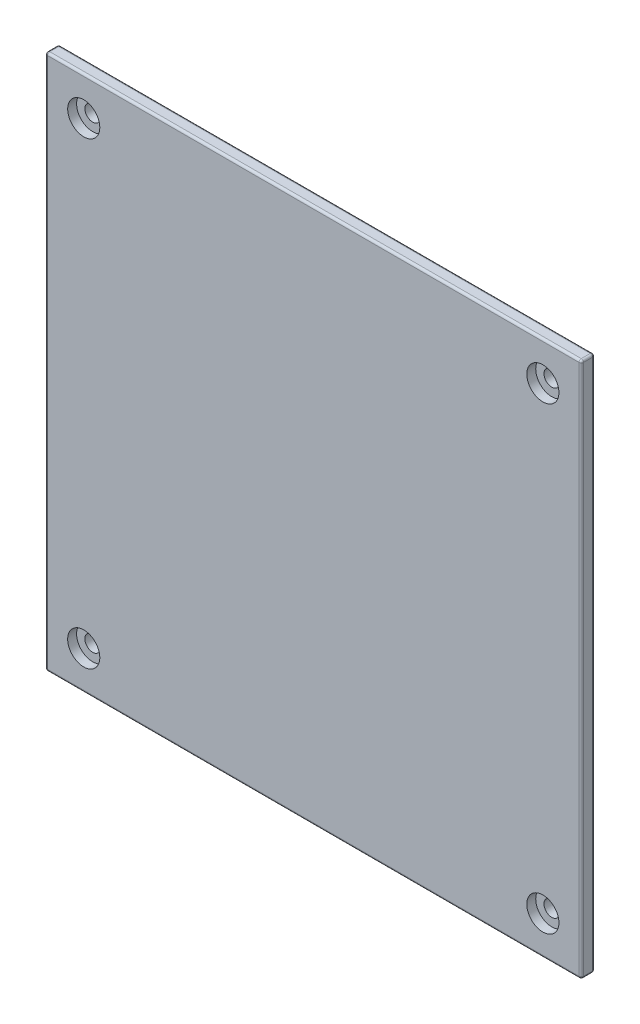
from build123d import *

# Parameters (mm, degrees)
ESBO_O1_W                 = 120
ESBO_O1_H                 = 120
RESSALTO_EXTRUS_O1_DEPTH  = 3
ESBO_O2_W                 = 112.8
ESBO_O2_H                 = 112.8
RESSALTO_EXTRUS_O2_DEPTH  = 2
ESBO_O3_W                 = 108.8
ESBO_O3_H                 = 108.8
CORTE_EXTRUS_O1_DEPTH     = 2
ESBO_O5_R                 = 5
RESSALTO_EXTRUS_O3_DEPTH  = 2
ESPELHAR2_COPY_1_SKETCH_R = 5
ESPELHAR2_COPY_1_DEPTH    = 2
CHANFRO1_SIZE             = 0.5
FILETE1_R                 = 2
ESBO_O6_R                 = 3.6
CORTE_EXTRUS_O2_DEPTH     = 2
ESBO_O7_R                 = 1.75
CORTE_EXTRUS_O3_DEPTH     = 85.905830189
ESPELHAR4_COPY_1_SKETCH_R = 3.6
ESPELHAR4_COPY_1_DEPTH    = 2
ESPELHAR4_COPY_2_SKETCH_R = 1.75
ESPELHAR4_COPY_2_DEPTH    = 85.905830189
FILETE2_R                 = 0.5


with BuildPart() as part:
    # Esboço1 → Ressalto-extrusão1 (new body)
    with BuildSketch(Plane.XY):
        Rectangle(ESBO_O1_W, ESBO_O1_H)
    extrude(amount=RESSALTO_EXTRUS_O1_DEPTH)

    # Esboço2 → Ressalto-extrusão2 (add)
    with BuildSketch(Plane(origin=(0, 0, 0), x_dir=(-1, 0, 0), z_dir=(0, 0, -1))):
        Rectangle(ESBO_O2_W, ESBO_O2_H)
    extrude(amount=RESSALTO_EXTRUS_O2_DEPTH)

    # Esboço3 → Corte-extrusão1 (cut)
    with BuildSketch(Plane(origin=(0, 0, -2), x_dir=(-1, 0, 0), z_dir=(0, 0, -1))):
        Rectangle(ESBO_O3_W, ESBO_O3_H)
    extrude(amount=-CORTE_EXTRUS_O1_DEPTH, mode=Mode.SUBTRACT)

    # Esboço5 → Ressalto-extrusão3 (add)
    with BuildSketch(Plane(origin=(0, 0, 0), x_dir=(-1, 0, 0), z_dir=(0, 0, -1))):
        with Locations((51.4, 51.4)):
            Circle(ESBO_O5_R)
    ressalto_extrus_o3 = extrude(amount=RESSALTO_EXTRUS_O3_DEPTH)

    # Espelhar1: Ressalto-extrusão3 across plane
    add(ressalto_extrus_o3.mirror(Plane(origin=(0, 0, 0), x_dir=(0, 0, 1), z_dir=(1, 0, 0))))

    # Espelhar2: Ressalto-extrusão3 across plane
    add(ressalto_extrus_o3.mirror(Plane.ZX))

    # Espelhar2 copy 1 sketch → Espelhar2 copy 1 (add)
    with BuildSketch(Plane(origin=(0, 0, 0), x_dir=(1, 0, 0), z_dir=(0, 0, -1))):
        with Locations((51.4, 51.4)):
            Circle(ESPELHAR2_COPY_1_SKETCH_R)
    extrude(amount=ESPELHAR2_COPY_1_DEPTH)

    # Chanfro1
    chanfro1_edges = [part.edges().sort_by_distance(p)[0] for p in [
        (0, 56.4, -2),
        (56.4, 0, -2),
        (0, -56.4, -2),
        (-56.4, 0, -2),
    ]]
    chamfer(chanfro1_edges, length=CHANFRO1_SIZE)

    # Filete1
    filete1_edges = [part.edges().sort_by_distance(p)[0] for p in [
        (0, -54.4, 0),
        (47.864466094, -47.864466094, 0),
        (54.4, 0, 0),
        (47.864466094, 47.864466094, 0),
        (0, 54.4, 0),
        (-47.864466094, 47.864466094, 0),
        (-54.4, 0, 0),
        (-47.864466094, -47.864466094, 0),
    ]]
    fillet(filete1_edges, radius=FILETE1_R - 0.0001)  # a hair under: the kernel refuses the full size

    # Esboço6 → Corte-extrusão2 (cut)
    with BuildSketch(Plane.XY.offset(3)):
        with Locations((-51.4, 51.4)):
            Circle(ESBO_O6_R)
    corte_extrus_o2 = extrude(amount=-CORTE_EXTRUS_O2_DEPTH, mode=Mode.SUBTRACT)

    # Esboço7 → Corte-extrusão3 (cut, through all)
    with BuildSketch(Plane.XY.offset(1)):
        with Locations((-51.4, 51.4)):
            Circle(ESBO_O7_R)
    corte_extrus_o3 = extrude(amount=-CORTE_EXTRUS_O3_DEPTH, mode=Mode.SUBTRACT)

    # Espelhar3: Corte-extrusão2, Corte-extrusão3 across plane
    add(corte_extrus_o2.mirror(Plane(origin=(0, 0, 0), x_dir=(0, 0, 1), z_dir=(1, 0, 0))), mode=Mode.SUBTRACT)
    add(corte_extrus_o3.mirror(Plane(origin=(0, 0, 0), x_dir=(0, 0, 1), z_dir=(1, 0, 0))), mode=Mode.SUBTRACT)

    # Espelhar4: Corte-extrusão2, Corte-extrusão3 across plane
    add(corte_extrus_o2.mirror(Plane.ZX), mode=Mode.SUBTRACT)
    add(corte_extrus_o3.mirror(Plane.ZX), mode=Mode.SUBTRACT)

    # Espelhar4 copy 1 sketch → Espelhar4 copy 1 (cut)
    with BuildSketch(Plane(origin=(0, 0, 3), x_dir=(-1, 0, 0), z_dir=(0, 0, 1))):
        with Locations((-51.4, 51.4)):
            Circle(ESPELHAR4_COPY_1_SKETCH_R)
    extrude(amount=-ESPELHAR4_COPY_1_DEPTH, mode=Mode.SUBTRACT)

    # Espelhar4 copy 2 sketch → Espelhar4 copy 2 (cut, through all)
    with BuildSketch(Plane(origin=(0, 0, 1), x_dir=(-1, 0, 0), z_dir=(0, 0, 1))):
        with Locations((-51.4, 51.4)):
            Circle(ESPELHAR4_COPY_2_SKETCH_R)
    extrude(amount=-ESPELHAR4_COPY_2_DEPTH, mode=Mode.SUBTRACT)

    # Filete2
    filete2_edges = [part.edges().sort_by_distance(p)[0] for p in [
        (-60, 0, 3),
        (0, -60, 3),
        (60, 0, 3),
        (0, -60, 0),
        (-60, 0, 0),
        (0, 60, 0),
        (60, 0, 0),
        (60, -60, 1.5),
        (-60, -60, 1.5),
        (-60, 60, 1.5),
        (60, 60, 1.5),
        (0, 60, 3),
    ]]
    fillet(filete2_edges, radius=FILETE2_R)


solid = part.part
